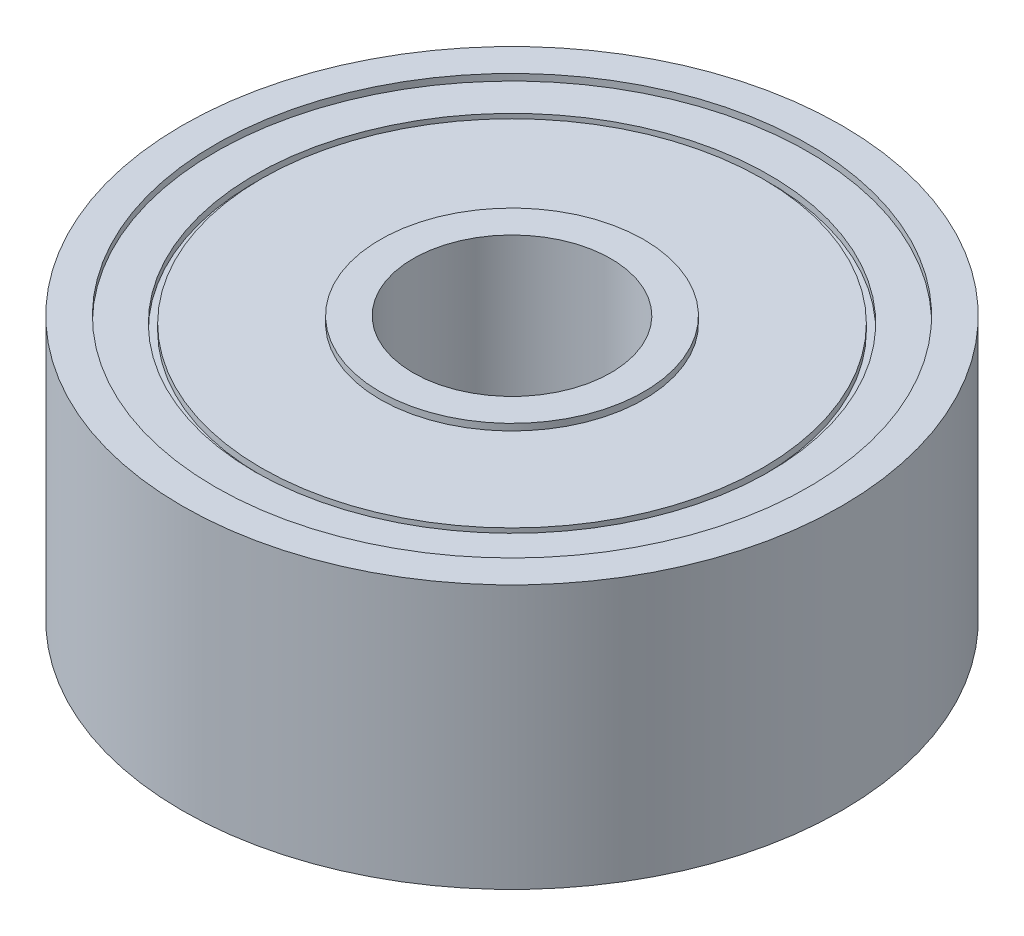
from build123d import *

# Parameters (mm, degrees)
SKETCH_1_R          = 5
SKETCH_1_R_2        = 1.5
EXTRUDE_1_DEPTH     = 2
SKETCH_2_R          = 4.5
SKETCH_2_R_2        = 2
CUT_EXTRUDE_1_DEPTH = 0.1
SKETCH_4_R          = 3.9
SKETCH_4_R_2        = 3.8
CUT_EXTRUDE_2_DEPTH = 0.1


with BuildPart() as part:
    # Эскиз1 → Бобышка-Вытянуть1 (new, symmetric)
    with BuildSketch(Plane(origin=(0, 0, 0), x_dir=(1, 0, 0), z_dir=(0, 1, 0))):
        Circle(SKETCH_1_R)
        Circle(SKETCH_1_R_2, mode=Mode.SUBTRACT)
    extrude(amount=EXTRUDE_1_DEPTH, both=True)

    # Эскиз2 → Вырез-Вытянуть1 (cut)
    with BuildSketch(Plane(origin=(0, 2, 0), x_dir=(1, 0, 0), z_dir=(0, 1, 0))):
        Circle(SKETCH_2_R)
        Circle(SKETCH_2_R_2, mode=Mode.SUBTRACT)
    cut_extrude_1 = extrude(amount=-CUT_EXTRUDE_1_DEPTH, mode=Mode.SUBTRACT)

    # Эскиз4 → Вырез-Вытянуть2 (cut)
    with BuildSketch(Plane(origin=(0, 1.9, 0), x_dir=(1, 0, 0), z_dir=(0, 1, 0))):
        Circle(SKETCH_4_R)
        Circle(SKETCH_4_R_2, mode=Mode.SUBTRACT)
    cut_extrude_2 = extrude(amount=-CUT_EXTRUDE_2_DEPTH, mode=Mode.SUBTRACT)

    # Зеркальное отражение1: Вырез-Вытянуть1, Вырез-Вытянуть2 across plane
    add(cut_extrude_1.mirror(Plane.ZX), mode=Mode.SUBTRACT)
    add(cut_extrude_2.mirror(Plane.ZX), mode=Mode.SUBTRACT)


solid = part.part
